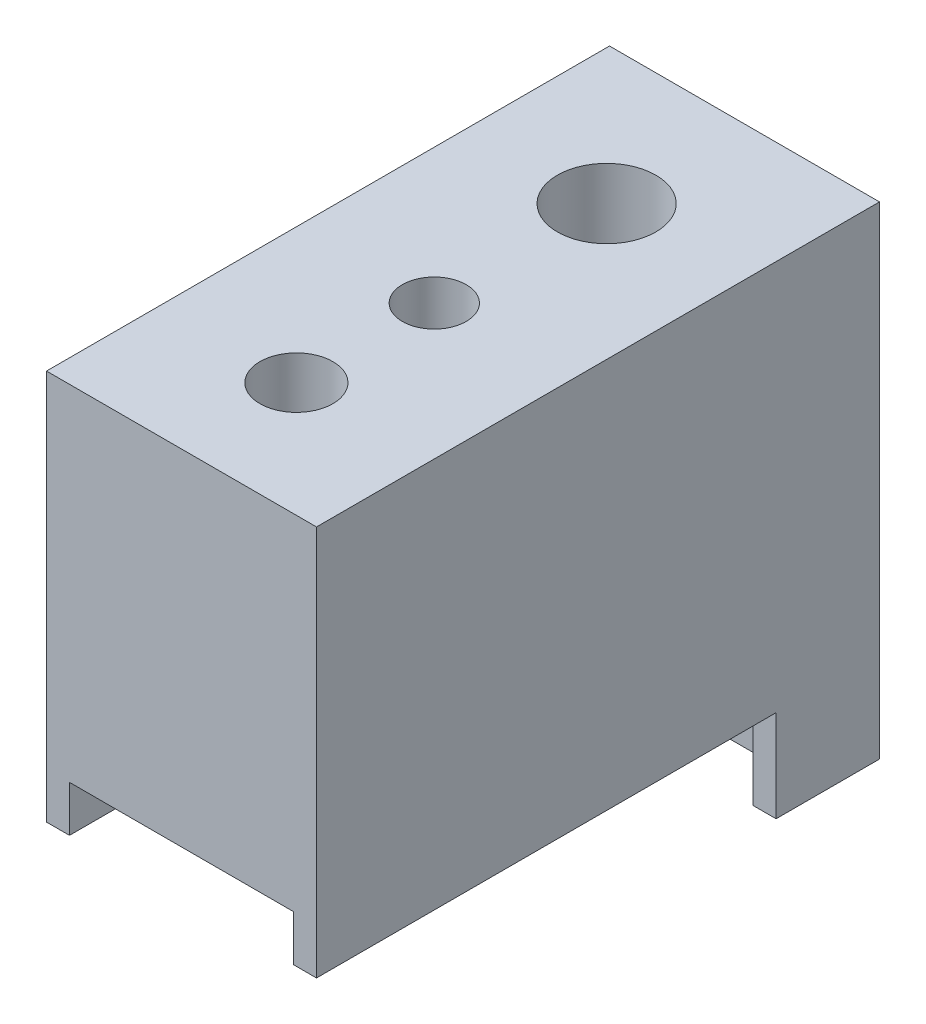
from build123d import *

# Parameters (mm, degrees)
BOSS_EXTRUDE1_DEPTH = 9.75
BOSS_EXTRUDE2_DEPTH = 2
SKETCH4_R           = 3.175
SKETCH4_R_2         = 2.78
SKETCH4_R_3         = 4.285
CUT_EXTRUDE1_DEPTH  = 55.534965848
SKETCH5_R           = 1.5
CUT_EXTRUDE2_DEPTH  = 55.534965848


with BuildPart() as part:
    # Sketch2 → Boss-Extrude1 (new, symmetric)
    with BuildSketch(Plane(origin=(0, 0, 0), x_dir=(0, 0, -1), z_dir=(1, 0, 0))):
        Polygon((-44, 0), (0, 0), (0, -12), (5, -12), (5, 30), (-44, 30), align=None)
    extrude(amount=BOSS_EXTRUDE1_DEPTH, both=True)

    # Sketch3 → Boss-Extrude2 (add)
    with BuildSketch(Plane(origin=(9.75, 0, 0), x_dir=(0, 0, -1), z_dir=(1, 0, 0))):
        Polygon((-44, 30), (-44, -4), (-4, -4), (-4, -12), (5, -12), (5, 30), align=None)
    boss_extrude2 = extrude(amount=BOSS_EXTRUDE2_DEPTH)

    # Mirror1: Boss-Extrude2 across plane
    add(boss_extrude2.mirror(Plane(origin=(0, 0, 0), x_dir=(0, 0, 1), z_dir=(1, 0, 0))))

    # Sketch4 → Cut-Extrude1 (cut, through all)
    with BuildSketch(Plane.XZ):
        with Locations((0, 34)):
            Circle(SKETCH4_R)
        with Locations((0, 22)):
            Circle(SKETCH4_R_2)
        with Locations((0, 7)):
            Circle(SKETCH4_R_3)
    extrude(amount=-CUT_EXTRUDE1_DEPTH, mode=Mode.SUBTRACT)

    # Sketch5 → Cut-Extrude2 (cut, through all)
    with BuildSketch(Plane.XY):
        with Locations((0, -7)):
            Circle(SKETCH5_R)
    extrude(amount=-CUT_EXTRUDE2_DEPTH, mode=Mode.SUBTRACT)


solid = part.part
